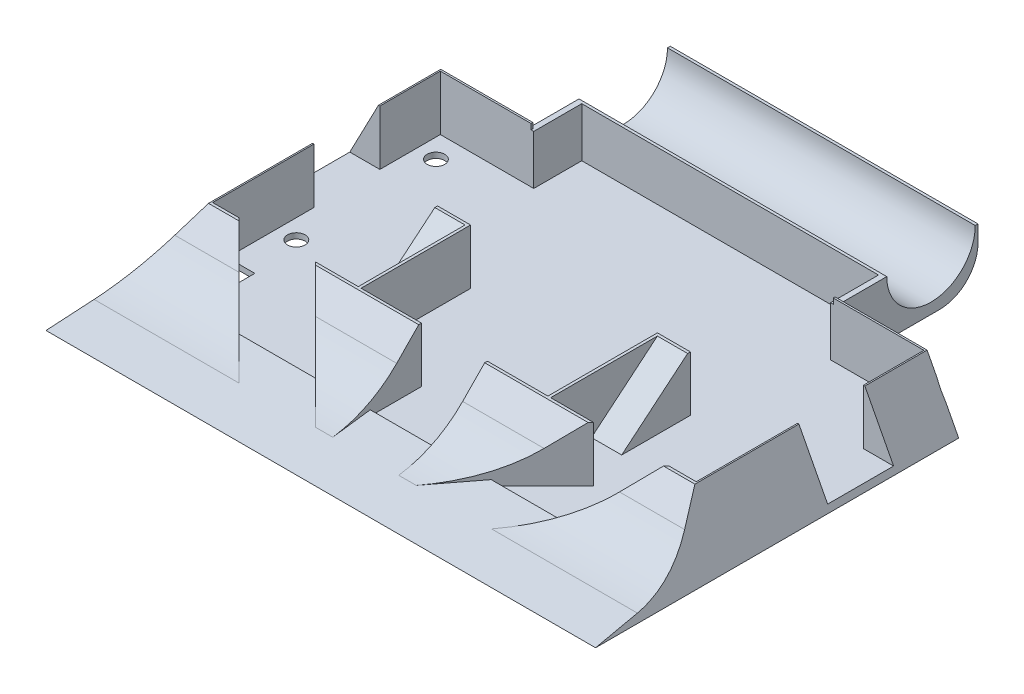
from build123d import *

# Parameters (mm, degrees)
SKETCH1_W             = 100
SKETCH1_H             = 95
BOSS_EXTRUDE2_DEPTH   = 20
CUT_EXTRUDE2_DEPTH    = 20
CUT_EXTRUDE3_START    = -22
CUT_EXTRUDE3_DEPTH    = 22
CUT_EXTRUDE4_DEPTH    = 2
SKETCH7_W             = 12
SKETCH7_H             = 10
CUT_EXTRUDE5_DEPTH    = 60
BOSS_EXTRUDE3_DEPTH   = 60
BOSS_EXTRUDE3_2_DEPTH = 60
SKETCH9_W             = 9.8
SKETCH9_H             = 15.2
CUT_EXTRUDE6_DEPTH    = 40
SKETCH10_W            = 9.7
SKETCH10_H            = 15.2
CUT_EXTRUDE7_DEPTH    = 40
SKETCH11_W            = 12
SKETCH11_H            = 10
CUT_EXTRUDE8_DEPTH    = 100
SKETCH12_W            = 39.436597342
SKETCH12_H            = 19.718298671
CUT_EXTRUDE9_DEPTH    = 100
CUT_EXTRUDE11_DEPTH   = 100
BOSS_EXTRUDE4_START   = -100
BOSS_EXTRUDE4_DEPTH   = 100
CUT_EXTRUDE12_REACH   = 95.581
SKETCH16_W            = 118.541652127
SKETCH16_H            = 71.876381232
SKETCH17_W            = 118.826271758
SKETCH17_H            = 93.94417767
CUT_EXTRUDE13_DEPTH   = 10
SKETCH18_R            = 8.1
CUT_EXTRUDE14_DEPTH   = 100
SKETCH19_W            = 45
SKETCH19_H            = 22.574653526
CUT_EXTRUDE16_DEPTH   = 10
SKETCH23_W            = 100
SKETCH23_H            = 16.30510129
BOSS_EXTRUDE6_DEPTH   = 10
SKETCH24_W            = 34
SKETCH24_H            = 21
CUT_EXTRUDE17_DEPTH   = 10
SKETCH25_W            = 45
SKETCH25_H            = 9.359456604
CUT_EXTRUDE18_DEPTH   = 10
SKETCH26_W            = 21
SKETCH26_H            = 34
CUT_EXTRUDE19_DEPTH   = 10
CUT_EXTRUDE20_DEPTH   = 22
CUT_EXTRUDE21_DEPTH   = 22
SKETCH29_W            = 15.251923191
SKETCH29_H            = 7.428393779
CUT_EXTRUDE22_DEPTH   = 10
CUT_EXTRUDE23_DEPTH   = 5.5
CUT_EXTRUDE24_DEPTH   = 5.5
BOSS_EXTRUDE9_DEPTH   = 100
SKETCH44_W            = 96.870466172
SKETCH44_H            = 84.683658551
CUT_EXTRUDE37_DEPTH   = 9.8
SKETCH45_W            = 7.532932596
SKETCH45_H            = 10
CUT_EXTRUDE38_DEPTH   = 100
SKETCH46_W            = 12
SKETCH46_H            = 85.376414904
CUT_EXTRUDE39_DEPTH   = 100
SKETCH47_W            = 144.570000294
SKETCH47_H            = 119.898222903
CUT_EXTRUDE40_DEPTH   = 2
CUT_EXTRUDE41_DEPTH   = 100
SKETCH49_W            = 33.934396209
SKETCH49_H            = 51.308285461
CUT_EXTRUDE44_DEPTH   = 9.7
SKETCH51_W            = 12
SKETCH51_H            = 7.5
BOSS_EXTRUDE13_DEPTH  = 2
CUT_EXTRUDE47_DEPTH   = 100
FILLET6_R             = 20
CUT_EXTRUDE48_DEPTH   = 100
SKETCH56_W            = 55
SKETCH56_H            = 18.976681206
CUT_EXTRUDE49_DEPTH   = 10
SKETCH57_W            = 12.959426316
SKETCH57_H            = 7.428393779
SKETCH57_W_2          = 11.011417888
CUT_EXTRUDE50_DEPTH   = 10
SKETCH58_W            = 33.922191822
SKETCH58_H            = 11
BOSS_EXTRUDE14_DEPTH  = 56
CUT_EXTRUDE52_DEPTH   = 100
SKETCH60_W            = 54.5
SKETCH60_H            = 8.411095911
CUT_EXTRUDE54_DEPTH   = 9
SKETCH62_W            = 9
SKETCH62_H            = 12
CUT_EXTRUDE55_DEPTH   = 3
SKETCH63_W            = 5
SKETCH63_H            = 7.358935777
SKETCH63_H_2          = 7.429646455
CUT_EXTRUDE56_DEPTH   = 3
CHAMFER1_SIZE         = 5
CHAMFER1_SIZE_2       = 1.819851171
CUT_EXTRUDE57_DEPTH   = 3
CUT_EXTRUDE58_DEPTH   = 3
CHAMFER3_START        = 4.100125042
CHAMFER3_DEPTH        = 0.925236243
SKETCH67_W            = 12
SKETCH67_H            = 10
CUT_EXTRUDE59_DEPTH   = 20
SKETCH68_W            = 12
SKETCH68_H            = 10
CUT_EXTRUDE60_DEPTH   = 20
SKETCH69_W            = 0.5
SKETCH69_H            = 0.325884987
BOSS_EXTRUDE15_DEPTH  = 9
SKETCH70_W            = 0.5
SKETCH70_H            = 8.736980898
BOSS_EXTRUDE16_DEPTH  = 9
SKETCH71_W            = 45
SKETCH71_H            = 1.571606221
CUT_EXTRUDE61_DEPTH   = 10
SKETCH72_W            = 47.768265836
SKETCH72_H            = 12.037959142
CUT_EXTRUDE62_DEPTH   = 10
CHAMFER4_START        = 4.610133616
CHAMFER4_DEPTH        = 1.951310752
FILLET10_R            = 7
SKETCH73_R            = 1.6
CUT_EXTRUDE63_DEPTH   = 20


with BuildPart() as part:
    # Sketch1 → Boss-Extrude2 (new body)
    with BuildSketch(Plane(origin=(0, 0, 0), x_dir=(1, 0, 0), z_dir=(0, 1, 0))):
        with Locations((9.900990099, -16.559405941)):
            Rectangle(SKETCH1_W, SKETCH1_H)
    extrude(amount=BOSS_EXTRUDE2_DEPTH)

    # Sketch2 → Cut-Extrude2 (cut)
    with BuildSketch(Plane(origin=(59.900990099, 0, 0), x_dir=(0, 0, -1), z_dir=(1, 0, 0))):
        with BuildLine():
            Line((-1.059405941, 0), (28.940594059, 0))
            Line((28.940594059, 0), (30.940594059, 0))
            Line((30.940594059, 0), (30.940594059, 20))
            Line((30.940594059, 20), (25.982188638, 20))
            Line((25.982188638, 20), (1.898999481, 20))
            ThreePointArc((1.898999481, 20), (-2.876419925, 10.487577267), (-1.059405941, 0))
        make_face()
    extrude(amount=-CUT_EXTRUDE2_DEPTH, mode=Mode.SUBTRACT)

    # Sketch3 → Cut-Extrude3 (cut)
    with BuildSketch(Plane.ZY.offset(40.099009901).offset(CUT_EXTRUDE3_START)):
        with BuildLine():
            Line((-1.898999481, 20), (-30.940594059, 20))
            Line((-30.940594059, 20), (-30.940594059, 0))
            Line((-30.940594059, 0), (1.059405941, 0))
            ThreePointArc((1.059405941, 0), (2.876419925, 10.487577267), (-1.898999481, 20))
        make_face()
    extrude(amount=CUT_EXTRUDE3_DEPTH, mode=Mode.SUBTRACT)

    # Sketch5 → Cut-Extrude4 (cut)
    with BuildSketch(Plane(origin=(39.900990099, 0, 0), x_dir=(0, 0, -1), z_dir=(1, 0, 0))):
        with BuildLine():
            Line((19.633434706, 24.018475751), (30.940594059, 20))
            Line((30.940594059, 20), (30.940594059, 0))
            Line((30.940594059, 0), (21.215348762, -7.364828148))
            ThreePointArc((21.215348762, -7.364828148), (-3.037850309, 7.144180617), (19.633434706, 24.018475751))
        make_face()
    extrude(amount=-CUT_EXTRUDE4_DEPTH, mode=Mode.SUBTRACT)

    # Sketch7 → Cut-Extrude5 (cut)
    with BuildSketch(Plane.XY.offset(64.059405941)):
        with Locations((9.900990099, 8)):
            Rectangle(SKETCH7_W, SKETCH7_H)
    extrude(amount=-CUT_EXTRUDE5_DEPTH, mode=Mode.SUBTRACT)

    # Sketch9 → Cut-Extrude6 (cut)
    with BuildSketch(Plane(origin=(33.98019802, 0, 33.98019802), x_dir=(0.7071067811865472, 0, -0.7071067811865479), z_dir=(0.7071067811865479, 0, 0.7071067811865472))):
        with Locations((-47.438423787, 10.6)):
            Rectangle(SKETCH9_W, SKETCH9_H)
    extrude(amount=-CUT_EXTRUDE6_DEPTH, mode=Mode.SUBTRACT)

    # Sketch10 → Cut-Extrude7 (cut)
    with BuildSketch(Plane(origin=(-24.079207921, 0, 24.079207921), x_dir=(0.7071067811865496, 0, 0.7071067811865456), z_dir=(-0.7071067811865456, 0, 0.7071067811865496))):
        with Locations((61.390538266, 10.6)):
            Rectangle(SKETCH10_W, SKETCH10_H)
    extrude(amount=-CUT_EXTRUDE7_DEPTH, mode=Mode.SUBTRACT)

    # Sketch11 → Cut-Extrude8 (cut)
    with BuildSketch(Plane(origin=(59.900990099, 0, 0), x_dir=(0, 0, -1), z_dir=(1, 0, 0))):
        with Locations((-19.876419925, 8)):
            Rectangle(SKETCH11_W, SKETCH11_H)
    extrude(amount=-CUT_EXTRUDE8_DEPTH, mode=Mode.SUBTRACT)

    # Sketch13 → Cut-Extrude11 (cut)
    with BuildSketch(Plane(origin=(59.900990099, 0, 0), x_dir=(0, 0, -1), z_dir=(1, 0, 0))):
        Polygon((-64.059405941, 0), (-54.059405941, 3), (-39.059405941, 20), (-64.059405941, 20), align=None)
    extrude(amount=-CUT_EXTRUDE11_DEPTH, mode=Mode.SUBTRACT)

    # Sketch15 → Boss-Extrude4 (add)
    with BuildSketch(Plane(origin=(59.900990099, 0, 0), x_dir=(0, 0, -1), z_dir=(1, 0, 0)).offset(BOSS_EXTRUDE4_START)):
        Polygon((-64.059405941, 0), (-69.059405941, 0), (-54.059405941, 3), align=None)
    extrude(amount=BOSS_EXTRUDE4_DEPTH)

    # Cut-Extrude12: up to this face of the body (flat: up to its plane)
    cut_extrude12_end = Plane(part.part.faces().sort_by_distance((9.900990099, 13, 21.397301034))[0])
    # Sketch16 → Cut-Extrude12 (cut, up to the picked face)
    with BuildSketch(Plane(origin=(0, 20, 0), x_dir=(1, 0, 0), z_dir=(0, 1, 0)), mode=Mode.PRIVATE) as cut_extrude12_sk1:
        with Locations((7.676480363, -3.191236494)):
            Rectangle(SKETCH16_W, SKETCH16_H)
    cut_extrude12_tool1 = split(extrude(cut_extrude12_sk1.sketch, amount=-CUT_EXTRUDE12_REACH, mode=Mode.PRIVATE), bisect_by=cut_extrude12_end, keep=Keep.BOTH, mode=Mode.PRIVATE)
    add(cut_extrude12_tool1.solids().sort_by(Axis((7.67648, 20, 3.191236), (0, -1, 0)))[0], mode=Mode.SUBTRACT)

    # Sketch17 → Cut-Extrude13 (cut)
    with BuildSketch(Plane(origin=(0, 13, 0), x_dir=(1, 0, 0), z_dir=(0, 1, 0))):
        with Locations((8.099723254, -37.149102118)):
            Rectangle(SKETCH17_W, SKETCH17_H)
    extrude(amount=CUT_EXTRUDE13_DEPTH, mode=Mode.SUBTRACT)

    # Sketch18 → Cut-Extrude14 (cut)
    with BuildSketch(Plane(origin=(37.900990099, 0, 0), x_dir=(0, 0, -1), z_dir=(1, 0, 0))):
        with Locations((14.018402237, 11)):
            Circle(SKETCH18_R)
    extrude(amount=-CUT_EXTRUDE14_DEPTH, mode=Mode.SUBTRACT)

    # Sketch19 → Cut-Extrude16 (cut)
    with BuildSketch(Plane(origin=(0, 13, 0), x_dir=(1, 0, 0), z_dir=(0, 1, 0))):
        with Locations((9.900990099, -7.118128307)):
            Rectangle(SKETCH19_W, SKETCH19_H)
    extrude(amount=-CUT_EXTRUDE16_DEPTH, mode=Mode.SUBTRACT)

    # Sketch23 → Boss-Extrude6 (add)
    with BuildSketch(Plane(origin=(0, 13, 0), x_dir=(1, 0, 0), z_dir=(0, 1, 0))):
        with Locations((9.900990099, -22.02897057)):
            Rectangle(SKETCH23_W, SKETCH23_H)
    extrude(amount=-BOSS_EXTRUDE6_DEPTH)

    # Sketch24 → Cut-Extrude17 (cut)
    with BuildSketch(Plane(origin=(0, 13, 0), x_dir=(1, 0, 0), z_dir=(0, 1, 0))):
        with Locations((9.900990099, -34.235876529)):
            Rectangle(SKETCH24_W, SKETCH24_H)
    extrude(amount=-CUT_EXTRUDE17_DEPTH, mode=Mode.SUBTRACT)

    # Sketch25 → Cut-Extrude18 (cut)
    with BuildSketch(Plane(origin=(0, 13, 0), x_dir=(1, 0, 0), z_dir=(0, 1, 0))):
        with Locations((9.900990099, -18.556148227)):
            Rectangle(SKETCH25_W, SKETCH25_H)
    extrude(amount=-CUT_EXTRUDE18_DEPTH, mode=Mode.SUBTRACT)

    # Sketch26 → Cut-Extrude19 (cut)
    with BuildSketch(Plane(origin=(0, 13, 0), x_dir=(1, 0, 0), z_dir=(0, 1, 0))):
        with Locations((-23.599009901, -20.30748275)):
            Rectangle(SKETCH26_W, SKETCH26_H)
        with Locations((43.400990099, -20.30748275)):
            Rectangle(SKETCH26_W, SKETCH26_H)
    extrude(amount=-CUT_EXTRUDE19_DEPTH, mode=Mode.SUBTRACT)

    # Sketch27 → Cut-Extrude20 (cut)
    with BuildSketch(Plane(origin=(59.900990099, 0, 0), x_dir=(0, 0, -1), z_dir=(1, 0, 0))):
        Polygon((-2.981597763, 6.375369602), (-2.981597763, 22.818607258), (10.704836096, 22.818607258), (10.704836096, 6.375369602), (11.352266392, 6.375369602), (11.352266392, -11.387239174), (-2.981597763, -11.387239174), align=None)
    extrude(amount=-CUT_EXTRUDE20_DEPTH, mode=Mode.SUBTRACT)

    # Sketch28 → Cut-Extrude21 (cut)
    with BuildSketch(Plane.ZY.offset(40.099009901)):
        Polygon((-10.420850948, 6.375369602), (-11.33614904, 6.375369602), (-11.33614904, 34.716091764), (2.981597763, 34.716091764), (2.981597763, 6.375369602), (2.981597763, -16.376944967), (-10.420850948, -16.376944967), align=None)
    extrude(amount=-CUT_EXTRUDE21_DEPTH, mode=Mode.SUBTRACT)

    # Sketch29 → Cut-Extrude22 (cut)
    with BuildSketch(Plane(origin=(0, 13, 0), x_dir=(1, 0, 0), z_dir=(0, 1, 0))):
        with Locations((-15.224971497, -41.02167964)):
            Rectangle(SKETCH29_W, SKETCH29_H)
        with Locations((35.026951694, -41.02167964)):
            Rectangle(SKETCH29_W, SKETCH29_H)
    extrude(amount=-CUT_EXTRUDE22_DEPTH, mode=Mode.SUBTRACT)

    # Sketch30 → Cut-Extrude23 (cut)
    with BuildSketch(Plane.ZY.offset(13.099009901)):
        Polygon((37.30748275, 3), (25.30748275, 13), (37.30748275, 13), align=None)
    extrude(amount=-CUT_EXTRUDE23_DEPTH, mode=Mode.SUBTRACT)

    # Sketch31 → Cut-Extrude24 (cut)
    with BuildSketch(Plane(origin=(32.900990099, 0, 0), x_dir=(0, 0, -1), z_dir=(1, 0, 0))):
        Polygon((-37.30748275, 3), (-37.30748275, 13), (-25.30748275, 13), align=None)
    extrude(amount=-CUT_EXTRUDE24_DEPTH, mode=Mode.SUBTRACT)

    # Sketch43 → Boss-Extrude9 (add)
    with BuildSketch(Plane(origin=(59.900990099, 0, 0), x_dir=(0, 0, -1), z_dir=(1, 0, 0))):
        Polygon((-69.059405941, 0), (-54.059405941, 3), (-45.235876529, 13), (-69.059405941, 13), align=None)
    extrude(amount=-BOSS_EXTRUDE9_DEPTH)

    # Sketch44 → Cut-Extrude37 (cut)
    with BuildSketch(Plane(origin=(-37.008854376, 0, 37.008854376), x_dir=(-0.7071067811865479, 0, -0.7071067811865472), z_dir=(0.7071067811865472, 0, -0.7071067811865479))):
        with Locations((-56.490489978, 45.341829276)):
            Rectangle(SKETCH44_W, SKETCH44_H)
    extrude(amount=CUT_EXTRUDE37_DEPTH, mode=Mode.SUBTRACT)

    # Sketch45 → Cut-Extrude38 (cut)
    with BuildSketch(Plane(origin=(4.205063327, 0, -4.205063327), x_dir=(0.7071067811865488, 0, 0.7071067811865464), z_dir=(-0.7071067811865464, 0, 0.7071067811865488))):
        with Locations((62.474071968, 8)):
            Rectangle(SKETCH45_W, SKETCH45_H)
    extrude(amount=CUT_EXTRUDE38_DEPTH, mode=Mode.SUBTRACT)

    # Sketch46 → Cut-Extrude39 (cut)
    with BuildSketch(Plane(origin=(0, 3, 0), x_dir=(1, 0, 0), z_dir=(0, 1, 0))):
        with Locations((9.900990099, -87.424083981)):
            Rectangle(SKETCH46_W, SKETCH46_H)
    extrude(amount=CUT_EXTRUDE39_DEPTH, mode=Mode.SUBTRACT)

    # Sketch47 → Cut-Extrude40 (cut)
    with BuildSketch(Plane(origin=(0, 0, 0), x_dir=(-1, 0, 0), z_dir=(0, -1, 0))):
        with Locations((-24.404405804, -23.651470154)):
            Rectangle(SKETCH47_W, SKETCH47_H)
    extrude(amount=-CUT_EXTRUDE40_DEPTH, mode=Mode.SUBTRACT)

    # Sketch48 → Cut-Extrude41 (cut)
    with BuildSketch(Plane(origin=(59.900990099, 0, 0), x_dir=(0, 0, -1), z_dir=(1, 0, 0))):
        Polygon((-69.059405941, 2), (-54.059405941, 4), (-45.235876529, 13), (-69.059405941, 13), align=None)
    extrude(amount=-CUT_EXTRUDE41_DEPTH, mode=Mode.SUBTRACT)

    # Sketch49 → Cut-Extrude44 (cut)
    with BuildSketch(Plane(origin=(39.98019802, 0, 39.98019802), x_dir=(0.7071067811865457, 0, -0.7071067811865495), z_dir=(0.7071067811865495, 0, 0.7071067811865457))):
        with Locations((-23.692743151, 28.654142731)):
            Rectangle(SKETCH49_W, SKETCH49_H)
    extrude(amount=CUT_EXTRUDE44_DEPTH, mode=Mode.SUBTRACT)


with BuildPart() as body_2:
    # Sketch8 → Boss-Extrude3 (new body)
    with BuildSketch(Plane(origin=(0, 20, 0), x_dir=(1, 0, 0), z_dir=(0, 1, 0))):
        Polygon((15.900990099, -64.059405941), (19.900990099, -68.059405941), (19.900990099, -64.059405941), align=None)
    extrude(amount=BOSS_EXTRUDE3_DEPTH)


with BuildPart() as body_3:
    # Sketch8 → Boss-Extrude3 2 (new body)
    with BuildSketch(Plane(origin=(0, 20, 0), x_dir=(1, 0, 0), z_dir=(0, 1, 0))):
        Polygon((3.900990099, -64.059405941), (-0.099009901, -68.059405941), (-0.099009901, -64.059405941), align=None)
    extrude(amount=BOSS_EXTRUDE3_2_DEPTH)


with BuildPart() as cut_extrude9_tool:
    # Sketch12 → Cut-Extrude9 (new body)
    with BuildSketch(Plane(origin=(0, 20, 0), x_dir=(1, 0, 0), z_dir=(0, 1, 0))):
        with Locations((5.957330365, -62.235437498)):
            Rectangle(SKETCH12_W, SKETCH12_H)
    extrude(amount=CUT_EXTRUDE9_DEPTH)


with BuildPart() as body_2_1:
    add(body_2.part)

    # Cut-Extrude9: cut by cut_extrude9_tool
    add(cut_extrude9_tool.part, mode=Mode.SUBTRACT)


with BuildPart() as body_3_1:
    add(body_3.part)

    # Cut-Extrude9: cut by cut_extrude9_tool
    add(cut_extrude9_tool.part, mode=Mode.SUBTRACT)


with BuildPart() as body_2_2:
    # of the pieces the cut leaves, the one that is kept (cut_extrude44_keep)
    add(part.part.solids().sort_by_distance((37.900990099, 2, -30.940594059))[0])

    # Sketch51 → Boss-Extrude13 (add)
    with BuildSketch(Plane(origin=(0, 3, 0), x_dir=(1, 0, 0), z_dir=(0, 1, 0))):
        with Locations((9.900990099, -57.809405941)):
            Rectangle(SKETCH51_W, SKETCH51_H)
        Polygon((1.400990099, -61.559405941), (-12.458302812, -61.559405941), (-19.958302812, -54.059405941), (-6.099009901, -54.059405941), align=None)
        Polygon((18.400990099, -61.559405941), (25.900990099, -54.059405941), (39.618861654, -54.059405941), (32.118861654, -61.559405941), align=None)
    extrude(amount=BOSS_EXTRUDE13_DEPTH)

    # Sketch54 → Cut-Extrude47 (cut)
    with BuildSketch(Plane(origin=(59.900990099, 0, 0), x_dir=(0, 0, -1), z_dir=(1, 0, 0))):
        Polygon((-69.059405941, 2), (-54.059405941, 4), (-46.862984026, 11.340350353), (-64.590291843, 12.008025107), align=None)
    extrude(amount=-CUT_EXTRUDE47_DEPTH, mode=Mode.SUBTRACT)

    # Fillet6
    fillet6_edges = [body_2_2.edges().sort_by_distance(p)[0] for p in [
        (-1.099009901, 4, 54.059405941),
        (-30.028656357, 4, 54.059405941),
        (49.759925877, 4, 54.059405941),
        (20.900990099, 4, 54.059405941),
    ]]
    fillet(fillet6_edges, radius=FILLET6_R)

    # Sketch55 → Cut-Extrude48 (cut)
    with BuildSketch(Plane(origin=(0, 0, 2.981597763), x_dir=(-1, 0, 0), z_dir=(0, 0, -1))):
        Polygon((-59.900990099, 2), (-54.150990099, 13), (-59.900990099, 13), align=None)
        Polygon((40.099009901, 2), (34.349009901, 13), (40.099009901, 13), align=None)
    extrude(amount=-CUT_EXTRUDE48_DEPTH, mode=Mode.SUBTRACT)

    # Sketch56 → Cut-Extrude49 (cut)
    with BuildSketch(Plane(origin=(0, 13, 0), x_dir=(1, 0, 0), z_dir=(0, 1, 0))):
        with Locations((9.900990099, -3.819142147)):
            Rectangle(SKETCH56_W, SKETCH56_H)
    extrude(amount=-CUT_EXTRUDE49_DEPTH, mode=Mode.SUBTRACT)

    # Sketch57 → Cut-Extrude50 (cut)
    with BuildSketch(Plane(origin=(0, 13, 0), x_dir=(1, 0, 0), z_dir=(0, 1, 0))):
        with Locations((-27.619296743, -41.02167964)):
            Rectangle(SKETCH57_W, SKETCH57_H)
        with Locations((48.395281155, -41.02167964)):
            Rectangle(SKETCH57_W_2, SKETCH57_H)
    extrude(amount=-CUT_EXTRUDE50_DEPTH, mode=Mode.SUBTRACT)

    # Sketch58 → Boss-Extrude14 (add)
    with BuildSketch(Plane(origin=(37.900990099, 0, 0), x_dir=(0, 0, -1), z_dir=(1, 0, 0))):
        with Locations((13.979498148, 7.5)):
            Rectangle(SKETCH58_W, SKETCH58_H)
    extrude(amount=-BOSS_EXTRUDE14_DEPTH)

    # Sketch59 → Cut-Extrude52 (cut)
    with BuildSketch(Plane(origin=(37.900990099, 0, 0), x_dir=(0, 0, -1), z_dir=(1, 0, 0))):
        with BuildLine():
            Line((5.929498148, 12), (-2.981597763, 12))
            Line((-2.981597763, 12), (-2.981597763, 13))
            Line((-2.981597763, 13), (10.800103806, 21.572693884))
            Line((10.800103806, 21.572693884), (31.372864154, 18.661867154))
            Line((31.372864154, 18.661867154), (30.940594059, 2))
            Line((30.940594059, 2), (22.529498148, 2))
            Line((22.529498148, 2), (22.529498148, 12))
            Line((22.529498148, 12), (22.029498148, 12))
            ThreePointArc((22.029498148, 12), (13.979498148, 3.95), (5.929498148, 12))
        make_face()
    extrude(amount=-CUT_EXTRUDE52_DEPTH, mode=Mode.SUBTRACT)

    # Sketch60 → Cut-Extrude54 (cut)
    with BuildSketch(Plane(origin=(0, 12, 0), x_dir=(1, 0, 0), z_dir=(0, 1, 0))):
        with Locations((9.650990099, 1.223950193)):
            Rectangle(SKETCH60_W, SKETCH60_H)
    extrude(amount=-CUT_EXTRUDE54_DEPTH, mode=Mode.SUBTRACT)

    # Sketch62 → Cut-Extrude55 (cut)
    with BuildSketch(Plane.XZ.offset(-2)):
        with Locations((53.400990099, 48.059405941)):
            Rectangle(SKETCH62_W, SKETCH62_H)
        with Locations((-33.599009901, 48.059405941)):
            Rectangle(SKETCH62_W, SKETCH62_H)
    extrude(amount=-CUT_EXTRUDE55_DEPTH, mode=Mode.SUBTRACT)

    # Sketch63 → Cut-Extrude56 (cut)
    with BuildSketch(Plane(origin=(0, 5, 0), x_dir=(-1, 0, 0), z_dir=(0, -1, 0))):
        with Locations((-51.400990099, -45.73887383)):
            Rectangle(SKETCH63_W, SKETCH63_H)
        with Locations((31.599009901, -45.774229168)):
            Rectangle(SKETCH63_W, SKETCH63_H_2)
    extrude(amount=-CUT_EXTRUDE56_DEPTH, mode=Mode.SUBTRACT)

    # Chamfer1
    # the kernel refuses this chamfer: 5, 1.819851171 mm, written as the material it takes off along each edge
    with BuildSketch(Plane(origin=(48.900990099, 5, 49.418341718), x_dir=(0, 0, 1), z_dir=(1, 0, 0))) as chamfer1_piece_1_section:
        Polygon((CHAMFER1_SIZE, 0), (0, -CHAMFER1_SIZE_2), (0, 0), align=None)
    chamfer1_piece_1 = extrude(amount=5, mode=Mode.PRIVATE)
    chamfer1_piece_1 = split(chamfer1_piece_1, bisect_by=Plane(origin=(48.900990099, 5, 54.059405941), z_dir=(0, 0, -1)), keep=Keep.TOP, mode=Mode.PRIVATE)
    add(chamfer1_piece_1, mode=Mode.SUBTRACT)
    with BuildSketch(Plane(origin=(-29.099009901, 5, 49.489052396), x_dir=(0, 0, 1), z_dir=(-1, 0, 0))) as chamfer1_piece_2_section:
        Polygon((CHAMFER1_SIZE, 0), (0, CHAMFER1_SIZE_2), (0, 0), align=None)
    chamfer1_piece_2 = extrude(amount=5, mode=Mode.PRIVATE)
    chamfer1_piece_2 = split(chamfer1_piece_2, bisect_by=Plane(origin=(-29.099009901, 5, 54.059405941), z_dir=(0, 0, -1)), keep=Keep.TOP, mode=Mode.PRIVATE)
    add(chamfer1_piece_2, mode=Mode.SUBTRACT)

    # Sketch65 → Cut-Extrude57 (cut)
    with BuildSketch(Plane.ZY.offset(-53.900990099)):
        Polygon((49.418341718, 6.819851171), (54.059405941, 5.130641939), (54.059405941, 5), (49.307446654, 5), align=None)
    extrude(amount=-CUT_EXTRUDE57_DEPTH, mode=Mode.SUBTRACT)

    # Sketch66 → Cut-Extrude58 (cut)
    with BuildSketch(Plane(origin=(-34.099009901, 0, 0), x_dir=(0, 0, -1), z_dir=(1, 0, 0))):
        Polygon((-49.489052396, 6.819851171), (-54.059405941, 5.156378521), (-54.059405941, 5), (-49.197438646, 5), align=None)
    extrude(amount=-CUT_EXTRUDE58_DEPTH, mode=Mode.SUBTRACT)

    # Chamfer3: read off the stored shape, not the designer's step
    # Chamfer3 outline → Chamfer3 (cut)
    with BuildSketch(Plane(origin=(0, 0, 0), x_dir=(0.8389187913531886, 0.41417570363718603, -0.3530916991818797), z_dir=(0.5442566136617039, -0.6384116829844108, 0.5442566136617057)).offset(CHAMFER3_START)):
        Polygon((-43.306372973, 41.976414042), (-45.332790806, 40.682725223), (-43.306372973, 39.389036403), align=None)
    extrude(amount=CHAMFER3_DEPTH, mode=Mode.SUBTRACT)

    # Sketch67 → Cut-Extrude59 (cut)
    with BuildSketch(Plane(origin=(-34.099009901, 0, 0), x_dir=(0, 0, -1), z_dir=(1, 0, 0))):
        with Locations((-20.30748275, 8)):
            Rectangle(SKETCH67_W, SKETCH67_H)
    extrude(amount=-CUT_EXTRUDE59_DEPTH, mode=Mode.SUBTRACT)

    # Sketch68 → Cut-Extrude60 (cut)
    with BuildSketch(Plane.ZY.offset(-53.900990099)):
        with Locations((20.30748275, 8)):
            Rectangle(SKETCH68_W, SKETCH68_H)
    extrude(amount=-CUT_EXTRUDE60_DEPTH, mode=Mode.SUBTRACT)

    # Sketch69 → Boss-Extrude15 (add)
    with BuildSketch(Plane(origin=(0, 12, 0), x_dir=(1, 0, 0), z_dir=(0, 1, 0))):
        with Locations((37.150990099, -3.144540257)):
            Rectangle(SKETCH69_W, SKETCH69_H)
    extrude(amount=-BOSS_EXTRUDE15_DEPTH)

    # Sketch70 → Boss-Extrude16 (add)
    with BuildSketch(Plane(origin=(0, 3, 0), x_dir=(1, 0, 0), z_dir=(0, 1, 0))):
        with Locations((-17.349009901, 1.061007699)):
            Rectangle(SKETCH70_W, SKETCH70_H)
    extrude(amount=BOSS_EXTRUDE16_DEPTH)

    # Sketch71 → Cut-Extrude61 (cut)
    with BuildSketch(Plane(origin=(0, 13, 0), x_dir=(1, 0, 0), z_dir=(0, 1, 0))):
        with Locations((9.900990099, -24.02167964)):
            Rectangle(SKETCH71_W, SKETCH71_H)
    extrude(amount=-CUT_EXTRUDE61_DEPTH, mode=Mode.SUBTRACT)

    # Sketch72 → Cut-Extrude62 (cut)
    with BuildSketch(Plane(origin=(0, 13, 0), x_dir=(1, 0, 0), z_dir=(0, 1, 0))):
        with Locations((10.785123017, -18.788503179)):
            Rectangle(SKETCH72_W, SKETCH72_H)
    extrude(amount=-CUT_EXTRUDE62_DEPTH, mode=Mode.SUBTRACT)

    # Chamfer4: read off the stored shape, not the designer's step
    # Chamfer4 outline → Chamfer4 (cut)
    with BuildSketch(Plane(origin=(0, 0, 0), x_dir=(0.8249016374005966, -0.41168718087087774, 0.3873641100055655), z_dir=(0.5652762940490381, 0.6007706906735452, -0.5652762940490402)).offset(CHAMFER4_START)):
        Polygon((60.845995289, -38.098530362), (60.845995289, -40.574729045), (62.906847059, -39.336629703), align=None)
    extrude(amount=CHAMFER4_DEPTH, mode=Mode.SUBTRACT)

    # Fillet10
    fillet10_edges = [body_2_2.edges().sort_by_distance(p)[0] for p in [
        (9.900990099, 2, -22.529498148),
    ]]
    fillet(fillet10_edges, radius=FILLET10_R)

    # Sketch73 → Cut-Extrude63 (cut)
    with BuildSketch(Plane(origin=(0, 3, 0), x_dir=(1, 0, 0), z_dir=(0, 1, 0))):
        with Locations(Location((-30.599009901, -7.60748275, 0), (0, 0, 270))):
            Circle(SKETCH73_R)
        with Locations(Location((-30.599009901, -33.00748275, 0), (0, 0, 270))):
            Circle(SKETCH73_R)
        with Locations(Location((50.400990099, -7.60748275, 0), (0, 0, 270))):
            Circle(SKETCH73_R)
        with Locations(Location((50.400990099, -33.00748275, 0), (0, 0, 270))):
            Circle(SKETCH73_R)
        with Locations(Location((-2.799009901, -41.235876529, 0), (0, 0, 270))):
            Circle(SKETCH73_R)
        with Locations(Location((22.600990099, -41.235876529, 0), (0, 0, 270))):
            Circle(SKETCH73_R)
    extrude(amount=-CUT_EXTRUDE63_DEPTH, mode=Mode.SUBTRACT)


solid = body_2_2.part
